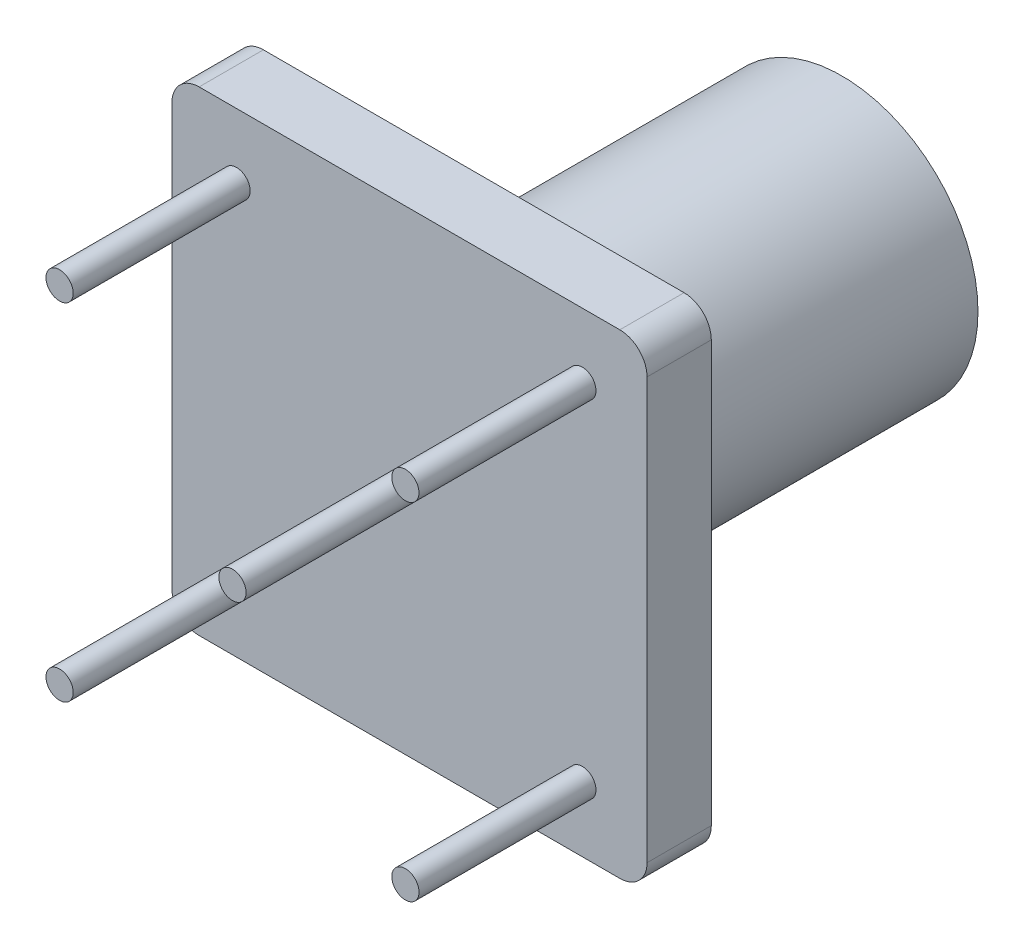
from build123d import *

# Parameters (mm, degrees)
EXTRUDE1_DEPTH     = 2.36
SKETCH2_R          = 5
EXTRUDE2_DEPTH     = 13.52
SKETCH3_R          = 4.5
CUT_EXTRUDE1_DEPTH = 13.52
SKETCH4_R          = 0.5
EXTRUDE3_DEPTH     = 6.5
EXTRUDE4_START     = 9
SKETCH5_R          = 0.5
EXTRUDE4_DEPTH     = 9


with BuildPart() as part:
    # Sketch1 → Extrude1 (new body)
    with BuildSketch(Plane.XY):
        with BuildLine():
            Line((1, 0), (16.45, 0))
            ThreePointArc((16.45, 0), (17.157106781, -0.292893219), (17.45, -1))
            Line((17.45, -1), (17.45, -16.45))
            ThreePointArc((17.45, -16.45), (17.157106781, -17.157106781), (16.45, -17.45))
            Line((16.45, -17.45), (1, -17.45))
            ThreePointArc((1, -17.45), (0.292893219, -17.157106781), (0, -16.45))
            Line((0, -16.45), (0, -1))
            ThreePointArc((0, -1), (0.292893219, -0.292893219), (1, 0))
        make_face()
    extrude(amount=EXTRUDE1_DEPTH)

    # Sketch2 → Extrude2 (add)
    with BuildSketch(Plane(origin=(0, 0, 0), x_dir=(-1, 0, 0), z_dir=(0, 0, -1))):
        with Locations((-8.725, -8.725)):
            Circle(SKETCH2_R)
    extrude(amount=EXTRUDE2_DEPTH)

    # Sketch3 → Cut-Extrude1 (cut)
    with BuildSketch(Plane(origin=(0, 0, -13.52), x_dir=(-1, 0, 0), z_dir=(0, 0, -1))):
        with Locations((-8.725, -8.725)):
            Circle(SKETCH3_R)
    extrude(amount=-CUT_EXTRUDE1_DEPTH, mode=Mode.SUBTRACT)

    # Sketch4 → Extrude3 (add)
    with BuildSketch(Plane.XY.offset(2.36)):
        with Locations((8.725, -8.725)):
            Circle(SKETCH4_R)
        with Locations((15.075, -2.375)):
            Circle(SKETCH4_R)
        with Locations((2.375, -2.375)):
            Circle(SKETCH4_R)
        with Locations((2.375, -15.075)):
            Circle(SKETCH4_R)
        with Locations((15.075, -15.075)):
            Circle(SKETCH4_R)
    extrude(amount=EXTRUDE3_DEPTH)

    # Sketch5 → Extrude4 (add)
    with BuildSketch(Plane(origin=(0, 0, 0), x_dir=(-1, 0, 0), z_dir=(0, 0, -1)).offset(EXTRUDE4_START)):
        with Locations((-8.725, -8.725)):
            Circle(SKETCH5_R)
    extrude(amount=-EXTRUDE4_DEPTH)


solid = part.part
